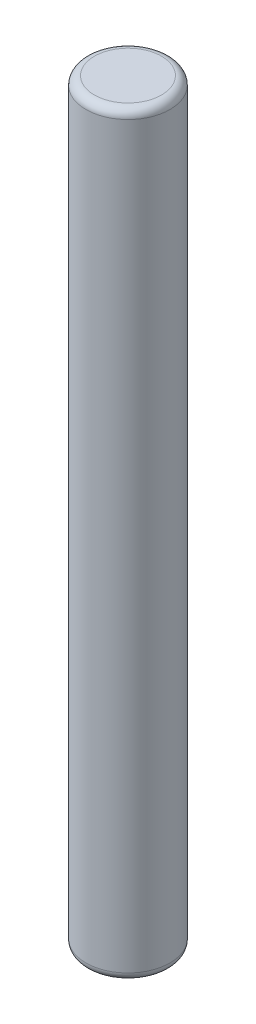
from build123d import *

# Parameters (mm, degrees)
SKETCH2_R           = 1
BOSS_EXTRUDE1_DEPTH = 18
FILLET1_R           = 0.2


with BuildPart() as part:
    # Sketch2 → Boss-Extrude1 (new body)
    with BuildSketch(Plane(origin=(0, 0, 0), x_dir=(1, 0, 0), z_dir=(0, 1, 0))):
        Circle(SKETCH2_R)
    extrude(amount=BOSS_EXTRUDE1_DEPTH)

    # Fillet1
    fillet1_edges = [part.edges().sort_by_distance(p)[0] for p in [
        (-1, 0, 0),
        (-1, 18, 0),
    ]]
    fillet(fillet1_edges, radius=FILLET1_R)


solid = part.part
